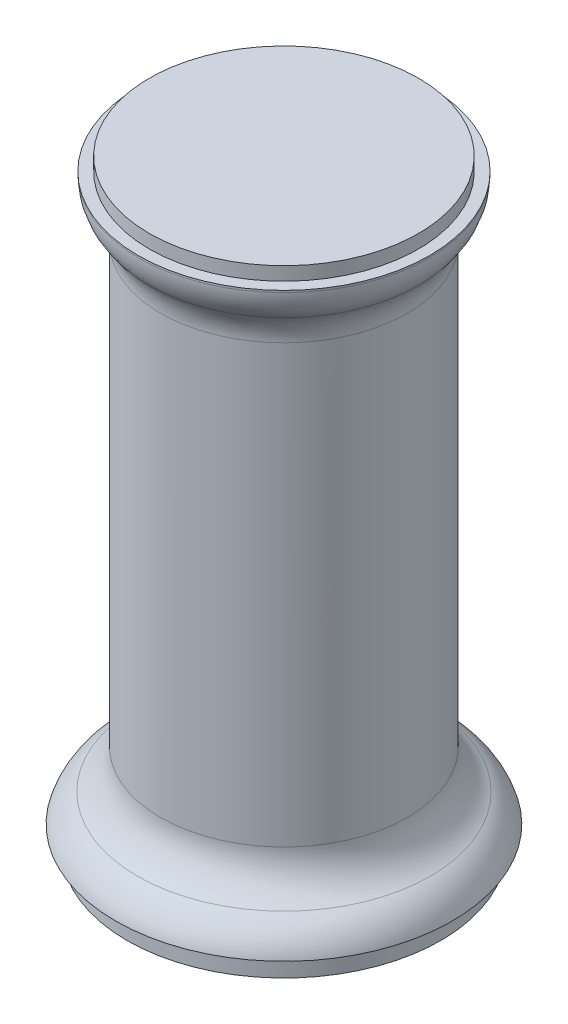
from build123d import *

# Parameters (mm, degrees)
SKETCH1_R           = 35
BOSS_EXTRUDE1_DEPTH = 5
SKETCH3_R           = 37.5
BOSS_EXTRUDE2_DEPTH = 5
SKETCH4_R           = 27.5
BOSS_EXTRUDE5_DEPTH = 116
SKETCH5_R           = 32.5
BOSS_EXTRUDE6_DEPTH = 5
SKETCH6_R           = 30
BOSS_EXTRUDE7_DEPTH = 3
FILLET1_R           = 10
FILLET2_R           = 10


with BuildPart() as part:
    # Sketch1 → Boss-Extrude1 (new body)
    with BuildSketch(Plane(origin=(0, 0, 0), x_dir=(1, 0, 0), z_dir=(0, 1, 0))):
        with Locations(Location((0, 0, 0), (0, 0, 270))):
            Circle(SKETCH1_R)
    extrude(amount=BOSS_EXTRUDE1_DEPTH)

    # Sketch3 → Boss-Extrude2 (add)
    with BuildSketch(Plane(origin=(0, 5, 0), x_dir=(1, 0, 0), z_dir=(0, 1, 0))):
        with Locations(Location((0, 0, 0), (0, 0, 270))):
            Circle(SKETCH3_R)
    extrude(amount=BOSS_EXTRUDE2_DEPTH)

    # Sketch4 → Boss-Extrude5 (add)
    with BuildSketch(Plane(origin=(0, 10, 0), x_dir=(1, 0, 0), z_dir=(0, 1, 0))):
        with Locations(Location((0, 0, 0), (0, 0, 90))):
            Circle(SKETCH4_R)
    extrude(amount=BOSS_EXTRUDE5_DEPTH)

    # Sketch5 → Boss-Extrude6 (add)
    with BuildSketch(Plane(origin=(0, 126, 0), x_dir=(1, 0, 0), z_dir=(0, 1, 0))):
        with Locations(Location((0, 0, 0), (0, 0, 270))):
            Circle(SKETCH5_R)
    extrude(amount=BOSS_EXTRUDE6_DEPTH)

    # Sketch6 → Boss-Extrude7 (add)
    with BuildSketch(Plane(origin=(0, 131, 0), x_dir=(1, 0, 0), z_dir=(0, 1, 0))):
        with Locations(Location((0, 0, 0), (0, 0, 270))):
            Circle(SKETCH6_R)
    extrude(amount=BOSS_EXTRUDE7_DEPTH)

    # Fillet1
    # the kernel refuses this fillet: 10 mm, written as the material it adds along each edge
    with BuildSketch(Plane(origin=(0, 10, 0), x_dir=(0, 0, -1), z_dir=(1, 0, 0))) as fillet1_piece_1:
        with BuildLine():
            CenterArc((27.5 + FILLET1_R, FILLET1_R), FILLET1_R, 180, 90)
            Line((27.5 + FILLET1_R, 0), (27.5 + FILLET1_R, -FILLET1_R * 0.02))
            Line((27.5 + FILLET1_R, -FILLET1_R * 0.02), (27.5 - FILLET1_R * 0.02, -FILLET1_R * 0.02))
            Line((27.5 - FILLET1_R * 0.02, -FILLET1_R * 0.02), (27.5 - FILLET1_R * 0.02, FILLET1_R))
            Line((27.5 - FILLET1_R * 0.02, FILLET1_R), (27.5, FILLET1_R))
        make_face()
    revolve(axis=Axis((0, 10, 0), (0, 1, 0)))
    with BuildSketch(Plane(origin=(0, 126, 0), x_dir=(0, 0, -1), z_dir=(1, 0, 0))) as fillet1_piece_2:
        with BuildLine():
            CenterArc((37.5, -8.660254038), FILLET1_R, 120, 60)
            Line((27.5, -8.660254038), (27.3, -8.660254038))
            Line((27.3, -8.660254038), (27.3, 0))
            Line((27.3, 0), (27.5, 0.2))
            ThreePointArc((27.5, 0.2), (30, 0.2), (32.4, 0.173205081))
            Line((32.4, 0.173205081), (32.5, 0))
        make_face()
    revolve(axis=Axis((0, 126, 0), (0, 1, 0)))

    # Fillet2
    # the kernel refuses this fillet: 10 mm, written as the material it takes off along each edge
    with BuildSketch(Plane(origin=(0, 126, 0), x_dir=(0, 0, 1), z_dir=(-1, 0, 0))) as fillet2_piece_1:
        with BuildLine():
            CenterArc((22.5, 4.568502517), FILLET2_R, 318.590377891, 41.409622109)
            Line((32.5, 4.568502517), (32.7, 4.568502517))
            Line((32.7, 4.568502517), (32.7, 0))
            Line((32.7, 0), (32.6, -0.173205081))
            ThreePointArc((32.6, -0.173205081), (31.293504258, -1.076098804), (30.15, -2.178163326))
            Line((30.15, -2.178163326), (30, -2.04587576))
        make_face()
    revolve(axis=Axis((0, 126, 0), (0, 1, 0)), revolution_arc=180, mode=Mode.SUBTRACT)
    with BuildSketch(Plane(origin=(0, 10, 0), x_dir=(0, 0, -1), z_dir=(1, 0, 0))) as fillet2_piece_2:
        with BuildLine():
            CenterArc((27.817541634, -7.5), FILLET2_R, 14.477512186, 46.567463442)
            Line((37.5, -5), (37.693649167, -4.95))
            ThreePointArc((37.693649167, -4.95), (37.7, -2.5), (37.7, 0))
            Line((37.7, 0), (37.5, 0.2))
            ThreePointArc((37.5, 0.2), (35.05, 0.511190802), (32.755595401, 1.425))
            Line((32.755595401, 1.425), (32.658770817, 1.25))
        make_face()
    revolve(axis=Axis((0, 10, 0), (0, 1, 0)), revolution_arc=180, mode=Mode.SUBTRACT)
    with BuildSketch(Plane(origin=(0, 10, 0), x_dir=(0, 0, 1), z_dir=(-1, 0, 0))) as fillet2_piece_3:
        with BuildLine():
            CenterArc((27.817541634, -7.5), FILLET2_R, 14.477512186, 46.567463442)
            Line((37.5, -5), (37.693649167, -4.95))
            ThreePointArc((37.693649167, -4.95), (37.7, -2.5), (37.7, 0))
            Line((37.7, 0), (37.5, 0.2))
            ThreePointArc((37.5, 0.2), (35.05, 0.511190802), (32.755595401, 1.425))
            Line((32.755595401, 1.425), (32.658770817, 1.25))
        make_face()
    revolve(axis=Axis((0, 10, 0), (0, 1, 0)), revolution_arc=180, mode=Mode.SUBTRACT)
    with BuildSketch(Plane(origin=(0, 126, 0), x_dir=(0, 0, -1), z_dir=(1, 0, 0))) as fillet2_piece_4:
        with BuildLine():
            CenterArc((22.5, 4.568502517), FILLET2_R, 318.590377891, 41.409622109)
            Line((32.5, 4.568502517), (32.7, 4.568502517))
            Line((32.7, 4.568502517), (32.7, 0))
            Line((32.7, 0), (32.6, -0.173205081))
            ThreePointArc((32.6, -0.173205081), (31.293504258, -1.076098804), (30.15, -2.178163326))
            Line((30.15, -2.178163326), (30, -2.04587576))
        make_face()
    revolve(axis=Axis((0, 126, 0), (0, 1, 0)), revolution_arc=180, mode=Mode.SUBTRACT)


solid = part.part
